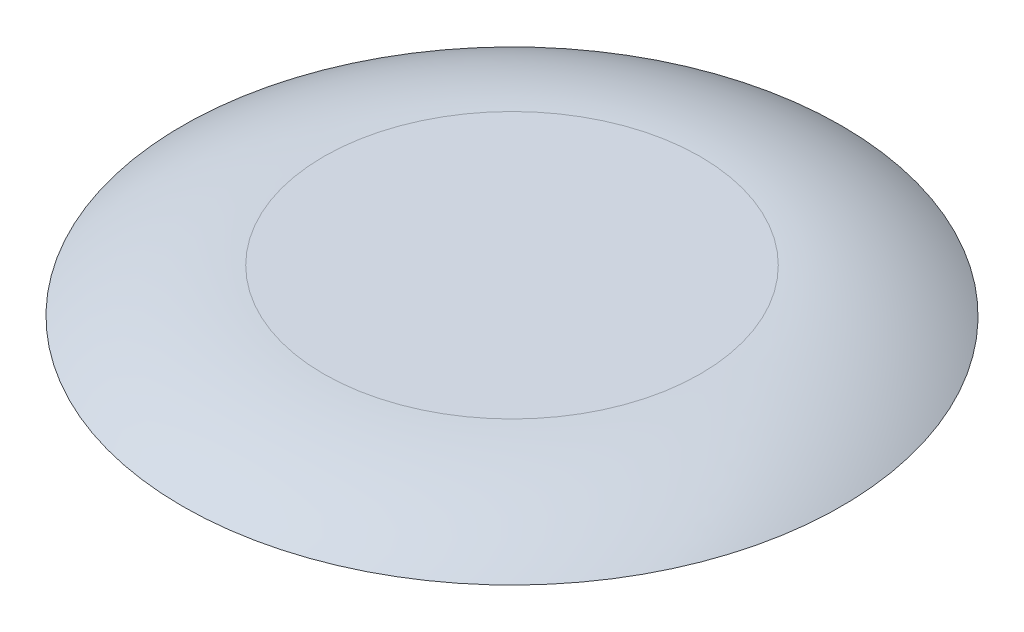
from build123d import *

# Parameters (mm, degrees)
SKETCH_1_R      = 22.5
EXTRUDE_5_DEPTH = 3
FILLET_3_R      = 17
SKETCH_4_R      = 22.5
EXTRUDE_6_DEPTH = 3
FILLET_4_R      = 17


with BuildPart() as part:
    # 草图1 → 凸台-拉伸5 (new body)
    with BuildSketch(Plane(origin=(0, 0, 0), x_dir=(1, 0, 0), z_dir=(0, 1, 0))):
        with Locations(Location((0, 0, 0), (0, 0, 270))):
            Circle(SKETCH_1_R)
    extrude(amount=EXTRUDE_5_DEPTH)

    # 圆角3
    # the kernel refuses this fillet: 17 mm, written as the material it takes off along each edge
    with BuildSketch(Plane(origin=(0, 3, 0), x_dir=(0, 0, 1), z_dir=(-1, 0, 0))) as fillet_3_piece_1:
        with BuildLine():
            CenterArc((12.856349239, -17), FILLET_3_R, 55.43967822, 34.56032178)
            Line((12.856349239, 0), (12.856349239, 0.34))
            Line((12.856349239, 0.34), (22.5, 0.34))
            Line((22.5, 0.34), (22.84, 0))
            ThreePointArc((22.84, 0), (22.84, -1.5), (22.692873015, -2.72))
            Line((22.692873015, -2.72), (22.5, -3))
        make_face()
    revolve(axis=Axis((0, 3, 0), (0, 1, 0)), mode=Mode.SUBTRACT)

    # 草图4 → 凸台-拉伸6 (add)
    with BuildSketch(Plane.XZ):
        with Locations(Location((0, 0, 0), (0, 0, 270))):
            Circle(SKETCH_4_R)
    extrude(amount=EXTRUDE_6_DEPTH)

    # 圆角4
    # the kernel refuses this fillet: 17 mm, written as the material it takes off along each edge
    with BuildSketch(Plane(origin=(0, -3, 0), x_dir=(0, 0, -1), z_dir=(-1, 0, 0))) as fillet_4_piece_1:
        with BuildLine():
            CenterArc((12.856349239, -17), FILLET_4_R, 55.43967822, 34.56032178)
            Line((12.856349239, 0), (12.856349239, 0.34))
            Line((12.856349239, 0.34), (22.5, 0.34))
            Line((22.5, 0.34), (22.84, 0))
            ThreePointArc((22.84, 0), (22.84, -1.5), (22.692873015, -2.72))
            Line((22.692873015, -2.72), (22.5, -3))
        make_face()
    revolve(axis=Axis((0, -3, 0), (0, -1, 0)), mode=Mode.SUBTRACT)


solid = part.part
